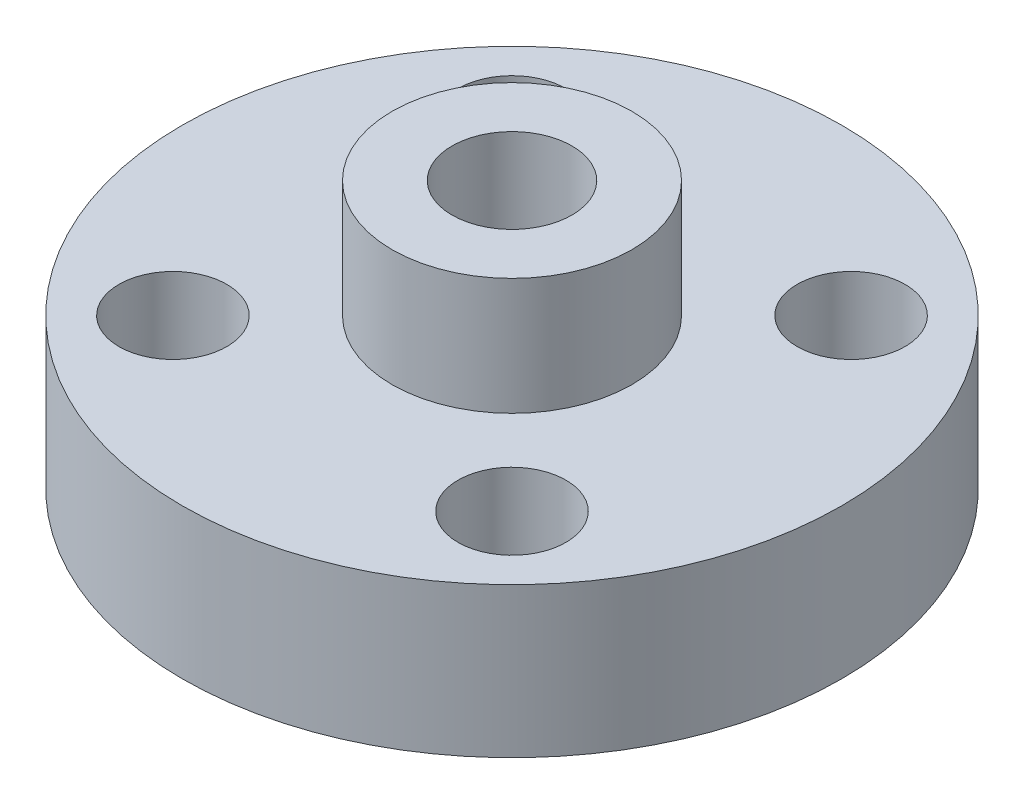
from build123d import *

# Parameters (mm, degrees)
SKETCH_1_R          = 11
EXTRUDE_1_DEPTH     = 5
SKETCH_2_R          = 4
EXTRUDE_2_DEPTH     = 3.9
SKETCH_3_R          = 1.8
CUT_EXTRUDE_1_DEPTH = 17.340134638
SKETCH_4_R          = 2
CUT_EXTRUDE_2_DEPTH = 18.922332437


with BuildPart() as part:
    # 스케치1 → 보스-돌출1 (new body)
    with BuildSketch(Plane(origin=(0, 0, 0), x_dir=(1, 0, 0), z_dir=(0, 1, 0))):
        Circle(SKETCH_1_R)
    extrude(amount=EXTRUDE_1_DEPTH)

    # 스케치2 → 보스-돌출2 (add)
    with BuildSketch(Plane(origin=(0, 5, 0), x_dir=(1, 0, 0), z_dir=(0, 1, 0))):
        Circle(SKETCH_2_R)
    extrude(amount=EXTRUDE_2_DEPTH)

    # 스케치3 → 컷-돌출1 (cut, through all)
    with BuildSketch(Plane(origin=(0, 5, 0), x_dir=(1, 0, 0), z_dir=(0, 1, 0))):
        with Locations((5.656854249, 5.656854249)):
            Circle(SKETCH_3_R)
        with Locations((-5.656854249, -5.656854249)):
            Circle(SKETCH_3_R)
        with Locations((-5.656854249, 5.656854249)):
            Circle(SKETCH_3_R)
        with Locations((5.656854249, -5.656854249)):
            Circle(SKETCH_3_R)
    extrude(amount=-CUT_EXTRUDE_1_DEPTH, mode=Mode.SUBTRACT)

    # 스케치4 → 컷-돌출2 (cut, through all)
    with BuildSketch(Plane(origin=(0, 8.9, 0), x_dir=(1, 0, 0), z_dir=(0, 1, 0))):
        Circle(SKETCH_4_R)
    extrude(amount=-CUT_EXTRUDE_2_DEPTH, mode=Mode.SUBTRACT)


solid = part.part
